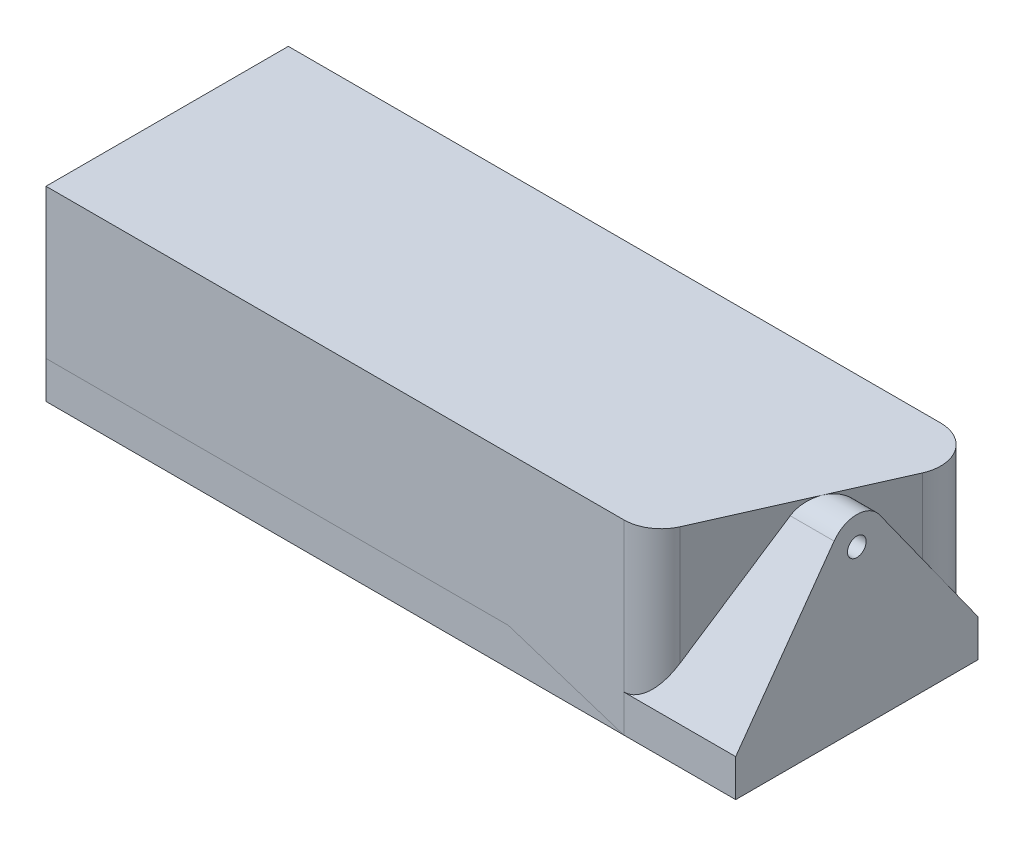
from build123d import *

# Parameters (mm, degrees)
BOSS_EXTRUDE1_DEPTH      = 15.875
BOSS_EXTRUDE2_DEPTH      = 10.31875
BOSS_EXTRUDE2_DEPTH_BACK = 10.31875
SKETCH3_R                = 0.79375
BOSS_EXTRUDE3_DEPTH      = 58.7375


with BuildPart() as part:
    # Sketch1 → Boss-Extrude1 (new body)
    with BuildSketch(Plane(origin=(0, 0, 0), x_dir=(1, 0, 0), z_dir=(0, 1, 0))):
        with BuildLine():
            Line((0, -10.31875), (0, 10.31875))
            Line((0, 10.31875), (55.5625, 10.31875))
            ThreePointArc((55.5625, 10.31875), (58.224712855, 8.873850492), (58.463851667, 5.85426037))
            Line((58.463851667, 5.85426037), (52.113851667, -8.43323963))
            ThreePointArc((52.113851667, -8.43323963), (50.942600492, -9.805962855), (49.2125, -10.31875))
            Line((49.2125, -10.31875), (0, -10.31875))
        make_face()
    extrude(amount=BOSS_EXTRUDE1_DEPTH)


with BuildPart() as body_2:
    # Sketch2 → Boss-Extrude2 (new, two sides: drawn at the far end of the back side and taken through both)
    with BuildSketch(Plane.XY.offset(-BOSS_EXTRUDE2_DEPTH_BACK)):
        Polygon((0, 0), (0, 3.175), (1.5875, 3.175), (1.5875, 15.875), (3.96875, 15.875), (3.96875, 3.175), (7.14375, 3.175), (7.14375, 15.875), (9.525, 15.875), (9.525, 3.175), (58.7375, 3.175), (58.7375, 0), align=None)
    extrude(amount=BOSS_EXTRUDE2_DEPTH + BOSS_EXTRUDE2_DEPTH_BACK)


with BuildPart() as body_3:
    # Sketch3 → Boss-Extrude3 (new body)
    with BuildSketch(Plane(origin=(0, 0, 0), x_dir=(0, 0, -1), z_dir=(1, 0, 0))):
        with BuildLine():
            Line((10.31875, 0), (-10.31875, 0))
            Line((-10.31875, 0), (-10.31875, 3.175))
            Line((-10.31875, 3.175), (-1.93598896, 14.880219729))
            ThreePointArc((-1.93598896, 14.880219729), (0, 15.875), (1.93598896, 14.880219729))
            Line((1.93598896, 14.880219729), (10.31875, 3.175))
            Line((10.31875, 3.175), (10.31875, 0))
        make_face()
        with Locations((0, 13.49375)):
            Circle(SKETCH3_R, mode=Mode.SUBTRACT)
    extrude(amount=BOSS_EXTRUDE3_DEPTH)


solid = Compound([part.part, body_2.part, body_3.part])
